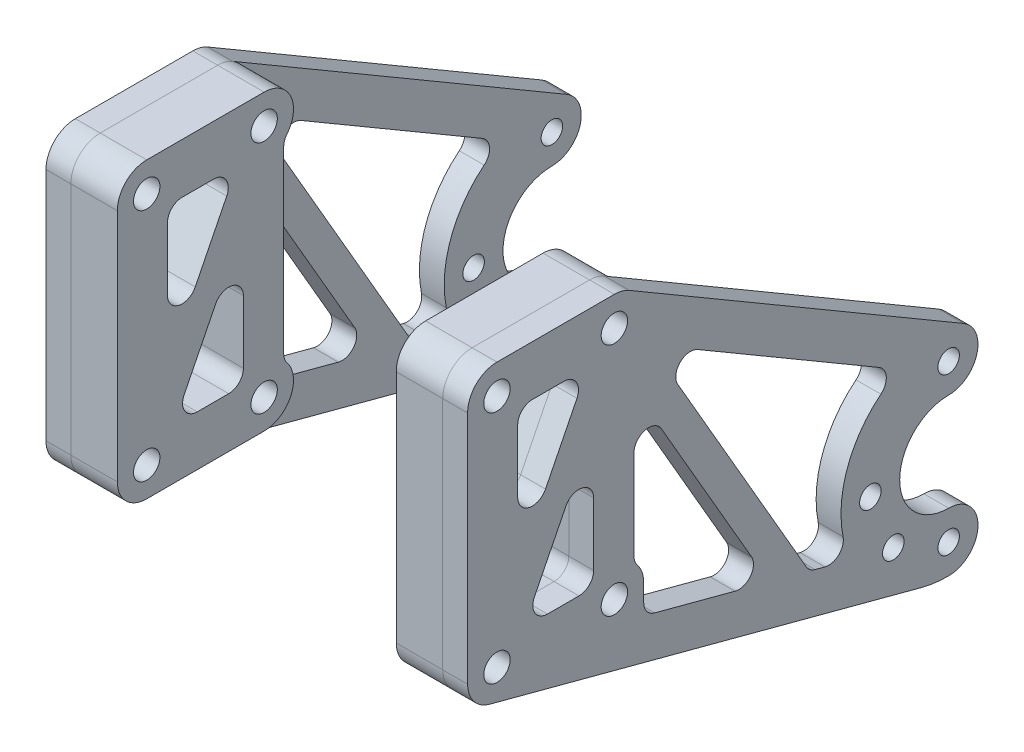
from build123d import *

# Parameters (mm, degrees)
BASE_FLANGE1_DEPTH     = 2.54
M2_5_CLEARANCE_HOLE1_D = 2.7
M2_CLEARANCE_HOLE1_D   = 2.2
SKETCH17_R             = 1.35
BOSS_EXTRUDE1_DEPTH    = 4.75
CUT_EXTRUDE1_DEPTH     = 404.966158493
CUT_EXTRUDE2_DEPTH     = 404.966158493
FILLET1_R              = 1.5
FILLET2_R              = 1.5


# Sheet-metal steps are written as plain solids
with BuildPart() as part:
    # Sketch6 → Base-Flange1 (new body)
    with BuildSketch(Plane(origin=(19, 0, 0), x_dir=(0, 0, -1), z_dir=(1, 0, 0))):
        with BuildLine():
            Line((-356.38124371, -10.630298526), (-400.480200917, 1.100827675))
            ThreePointArc((-400.480200917, 1.100827675), (-402.087381376, 2.17157144), (-402.708968249, 4))
            Line((-402.708968249, 4), (-402.708968249, 28))
            ThreePointArc((-402.708968249, 28), (-401.830288592, 30.121320344), (-399.708968249, 31))
            Line((-399.708968249, 31), (-387.708968249, 31))
            ThreePointArc((-387.708968249, 31), (-386.923629675, 30.895383105), (-386.193064223, 30.588828883))
            Line((-386.193064223, 30.588828883), (-352.037486568, 10.588828883))
            ThreePointArc((-352.037486568, 10.588828883), (-350.658007488, 7.214661426), (-353.553390593, 5))
            ThreePointArc((-353.553390593, 5), (-358.553390593, 0), (-353.553390593, -5))
            ThreePointArc((-353.553390593, -5), (-350.553390593, -8), (-353.553390593, -11))
            ThreePointArc((-353.553390593, -11), (-354.979349256, -10.907183041), (-356.38124371, -10.630298526))
        make_face()
    extrude(amount=BASE_FLANGE1_DEPTH)

    # M2.5 Clearance Hole1 (through all)
    with Locations(Plane(origin=(21.54, 0, 0), x_dir=(0, 0, -1), z_dir=(1, 0, 0))):
        with Locations((-399.708968249, 28), (-387.708968249, 28), (-387.708968249, 4), (-399.708968249, 4)):
            Hole(M2_5_CLEARANCE_HOLE1_D / 2)

    # M2 Clearance Hole1 (through all)
    with Locations(Plane(origin=(21.54, 0, 0), x_dir=(0, 0, -1), z_dir=(1, 0, 0))):
        with Locations((-353.553390593, 8), (-16.75, -44.75), (-361.553390593, 0), (-353.553390593, -8), (-359.210244843, -5.656854249)):
            Hole(M2_CLEARANCE_HOLE1_D / 2)


with BuildPart() as body_2:
    # Sketch17 → Boss-Extrude1 (new body)
    with BuildSketch(Plane.ZY.offset(-19)):
        with BuildLine():
            Line((387.708968249, 31), (399.708968249, 31))
            ThreePointArc((399.708968249, 31), (401.830288592, 30.121320344), (402.708968249, 28))
            Line((402.708968249, 28), (402.708968249, 4))
            ThreePointArc((402.708968249, 4), (401.830288592, 1.878679656), (399.708968249, 1))
            Line((399.708968249, 1), (387.708968249, 1))
            ThreePointArc((387.708968249, 1), (385.587647905, 1.878679656), (384.708968249, 4))
            Line((384.708968249, 4), (384.708968249, 28))
            ThreePointArc((384.708968249, 28), (385.587647905, 30.121320344), (387.708968249, 31))
        make_face()
        with Locations((387.708968249, 4)):
            Circle(SKETCH17_R, mode=Mode.SUBTRACT)
        with Locations((399.708968249, 4)):
            Circle(SKETCH17_R, mode=Mode.SUBTRACT)
        with Locations((399.708968249, 28)):
            Circle(SKETCH17_R, mode=Mode.SUBTRACT)
        with Locations((387.708968249, 28)):
            Circle(SKETCH17_R, mode=Mode.SUBTRACT)
    extrude(amount=BOSS_EXTRUDE1_DEPTH)


with BuildPart() as cut_extrude1_tool:
    # Sketch15 → Cut-Extrude1 (new, through all)
    with BuildSketch(Plane(origin=(21.54, 0, 0), x_dir=(0, 0, -1), z_dir=(1, 0, 0))):
        Polygon((-396.971257094, 6.121320344), (-389.830288592, 6.121320344), (-389.830288592, 20.403257347), align=None)
        with BuildLine():
            Line((-385.708968249, 21.54331737), (-385.708968249, 6.236067977))
            ThreePointArc((-385.708968249, 6.236067977), (-384.970355461, 5.224744871), (-384.708968249, 4))
            Line((-384.708968249, 4), (-384.708968249, 1.044504755))
            Line((-384.708968249, 1.044504755), (-371.886710454, -2.366449469))
            Line((-371.886710454, -2.366449469), (-385.708968249, 21.54331737))
        make_face()
        Polygon((-397.587647905, 11.596742653), (-390.446679404, 25.878679656), (-397.587647905, 25.878679656), align=None)
        with BuildLine():
            Line((-384.076965724, 24.714434352), (-367.791735007, -3.455787558))
            Line((-367.791735007, -3.455787558), (-363.55303113, -4.583360028))
            ThreePointArc((-363.55303113, -4.583360028), (-363.94829352, 3.598054077), (-358.579816843, 9.784428402))
            Line((-358.579816843, 9.784428402), (-384.076965724, 24.714434352))
        make_face()
    extrude(amount=-CUT_EXTRUDE1_DEPTH)


with BuildPart() as part_1:
    add(part.part)

    # Cut-Extrude1: cut by cut_extrude1_tool
    add(cut_extrude1_tool.part, mode=Mode.SUBTRACT)

    # Fillet1
    fillet1_edges = [part_1.edges().sort_by_distance(p)[0] for p in [
        (20.27, 6.121320344, 396.971257094),
        (20.27, 20.403257347, 389.830288592),
        (20.27, 6.121320344, 389.830288592),
        (20.27, 6.236067977, 385.708968249),
        (20.27, 21.54331737, 385.708968249),
        (20.27, -2.366449469, 371.886710454),
        (20.27, 1.044504755, 384.708968249),
        (20.27, 9.784428402, 358.579816843),
        (20.27, -4.583360028, 363.55303113),
        (20.27, -3.455787558, 367.791735007),
        (20.27, 24.714434352, 384.076965724),
        (20.27, 11.596742653, 397.587647905),
        (20.27, 25.878679656, 397.587647905),
        (20.27, 25.878679656, 390.446679404),
    ]]
    fillet(fillet1_edges, radius=FILLET1_R)


with BuildPart() as body_2_1:
    add(body_2.part)

    # Cut-Extrude1: cut by cut_extrude1_tool
    add(cut_extrude1_tool.part, mode=Mode.SUBTRACT)

    # Sketch20 → Cut-Extrude2 (cut, through all)
    with BuildSketch(Plane.ZY.offset(-14.25)):
        with BuildLine():
            Line((385.708968249, 21.54331737), (385.708968249, 25.763932023))
            ThreePointArc((385.708968249, 25.763932023), (384.970355461, 26.775255129), (384.708968249, 28))
            Line((384.708968249, 28), (384.708968249, 19.81351554))
            Line((384.708968249, 19.81351554), (385.708968249, 21.54331737))
        make_face()
    extrude(amount=-CUT_EXTRUDE2_DEPTH, mode=Mode.SUBTRACT)

    # Fillet2
    fillet2_edges = [body_2_1.edges().sort_by_distance(p)[0] for p in [
        (16.625, 25.763932023, 385.708968249),
        (16.625, 11.596742653, 397.587647905),
        (16.625, 25.878679656, 397.587647905),
        (16.625, 25.878679656, 390.446679404),
        (16.625, 6.121320344, 396.971257094),
        (16.625, 20.403257347, 389.830288592),
        (16.625, 6.121320344, 389.830288592),
        (16.625, 6.236067977, 385.708968249),
    ]]
    fillet(fillet2_edges, radius=FILLET2_R)


with BuildPart() as body_3:
    # Mirror1: mirrored copy
    add(body_2_1.part.mirror(Plane(origin=(0, 0, 0), x_dir=(0, 0, 1), z_dir=(1, 0, 0))))


with BuildPart() as body_4:
    # Mirror2: mirrored copy
    add(part_1.part.mirror(Plane(origin=(0, 0, 0), x_dir=(0, 0, 1), z_dir=(1, 0, 0))))


solid = Compound([part_1.part, body_2_1.part, body_3.part, body_4.part])
